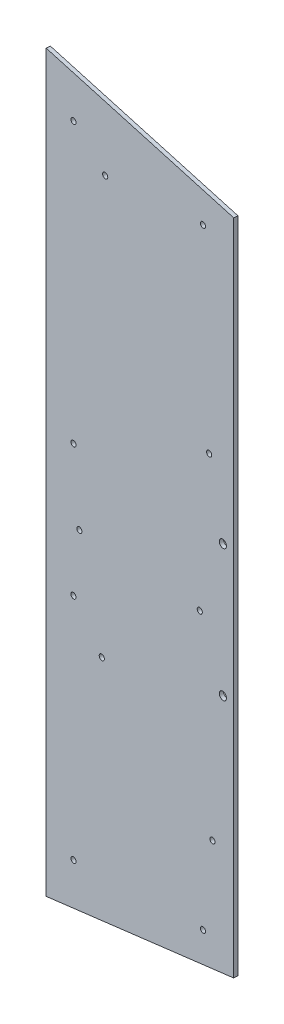
from build123d import *

# Parameters (mm, degrees)
BOSS_EXTRUDE1_DEPTH  = 3.175
CUT_EXTRUDE2_DEPTH   = 880.199971547
M4_CLEARANCE_HOLE1_D = 4.5
SKETCH6_R            = 3.175
CUT_EXTRUDE3_DEPTH   = 460.193465743


with BuildPart() as part:
    # Sketch1 → Boss-Extrude1 (new body)
    with BuildSketch(Plane(origin=(1.950344864, 0, -26.264644174), x_dir=(-0.9972542674746705, 0, -0.07405353471346578), z_dir=(0.07405353471346578, 0, -0.9972542674746705))):
        Polygon((-183.644373355, -298.45), (-183.644373355, 298.45), (-826.760197391, 177.8), (-826.760197391, -177.8), align=None)
    extrude(amount=BOSS_EXTRUDE1_DEPTH)

    # Sketch3 → Cut-Extrude2 (cut, through all)
    with BuildSketch(Plane(origin=(1.950344864, 0, -26.264644174), x_dir=(0.9972542674746705, 0, 0.0740535347134658), z_dir=(-0.0740535347134658, 0, 0.9972542674746706))):
        Polygon((348.744373355, 267.476862261), (348.744373355, -267.476862261), (826.760197391, -177.8), (826.760197391, 177.8), align=None)
    extrude(amount=-CUT_EXTRUDE2_DEPTH, mode=Mode.SUBTRACT)

    # M4 Clearance Hole1 (through all)
    with Locations(Plane(origin=(2.185464837, 0, -29.430926473), x_dir=(-0.9972542674746705, 0, -0.0740535347134658), z_dir=(0.0740535347134658, 0, -0.9972542674746706))):
        with Locations((-321.719114705, 248.051870805), (-207.719373355, 260), (-207.719373355, 33), (-207.719373355, -260), (-207.719373355, -74), (-321.719114705, -248.051870805), (-330.006873355, -180.725), (-232.644373355, -104), (-318.894373355, -25), (-212.894373355, -25), (-235.644373355, 236.6), (-327.144373355, 90)):
            Hole(M4_CLEARANCE_HOLE1_D / 2)

    # Sketch6 → Cut-Extrude3 (cut, through all)
    with BuildSketch(Plane(origin=(1.950344864, 0, -26.264644174), x_dir=(0.9972542674746705, 0, 0.0740535347134658), z_dir=(-0.0740535347134658, 0, 0.9972542674746706))):
        with Locations((339.219373355, 33)):
            Circle(SKETCH6_R)
        with Locations((339.219373355, -74)):
            Circle(SKETCH6_R)
    extrude(amount=-CUT_EXTRUDE3_DEPTH, mode=Mode.SUBTRACT)


solid = part.part
